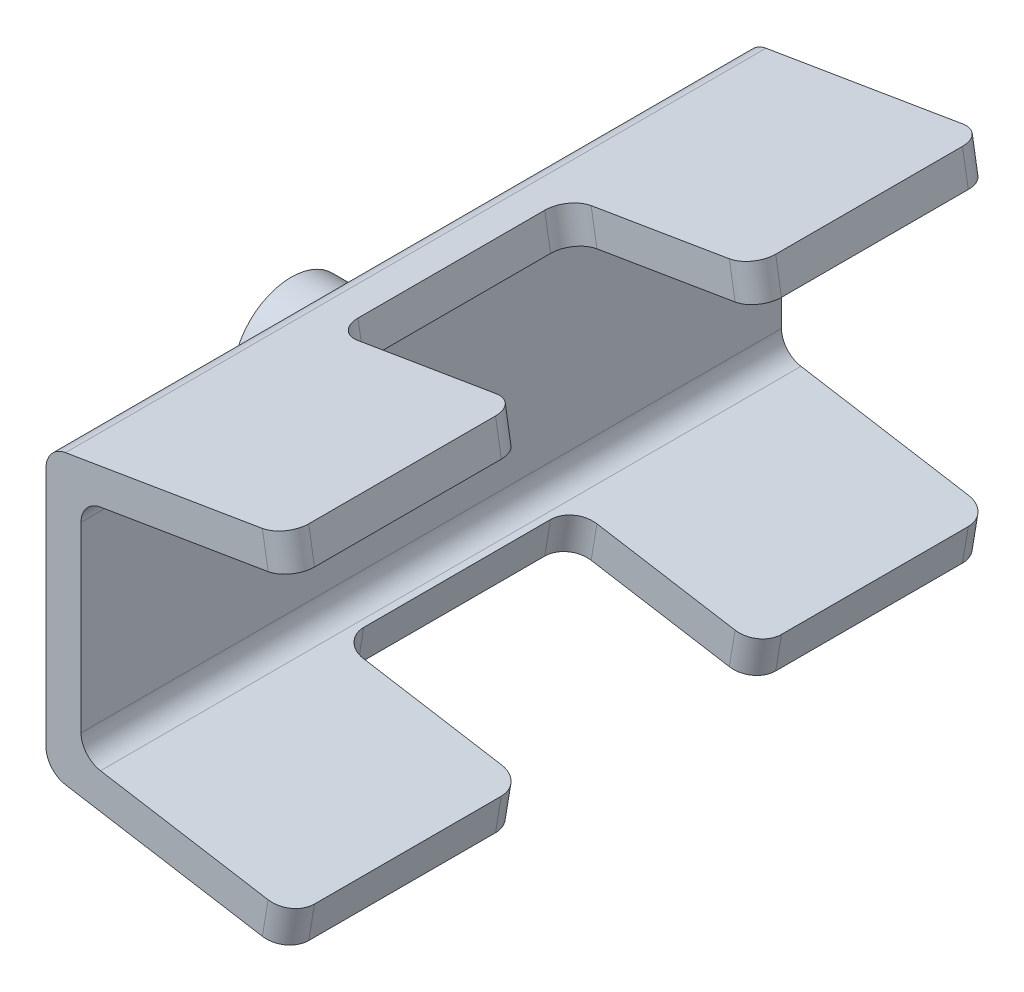
from build123d import *

# Parameters (mm, degrees)
SKETCH1_R           = 63.5
BOSS_EXTRUDE1_DEPTH = 63.5
BOSS_EXTRUDE2_DEPTH = 381
CUT_EXTRUDE1_DEPTH  = 203.2
CUT_EXTRUDE2_DEPTH  = 203.2
FILLET1_R           = 25.4
FILLET2_R           = 25.4
FILLET3_R           = 25.4


with BuildPart() as part:
    # Sketch1 → Boss-Extrude1 (new, symmetric)
    with BuildSketch(Plane(origin=(0, 0, 0), x_dir=(0, 0, -1), z_dir=(1, 0, 0))):
        Circle(SKETCH1_R)
    extrude(amount=BOSS_EXTRUDE1_DEPTH, both=True)

    # Sketch2 → Boss-Extrude2 (add, symmetric)
    with BuildSketch(Plane.XY):
        Polygon((88.9, -120.65), (88.9, 120.65), (317.5, 158.75), (311.236398584, 196.331608498), (50.8, 152.925542067), (50.8, -152.925542067), (311.236398584, -196.331608498), (317.5, -158.75), align=None)
    extrude(amount=BOSS_EXTRUDE2_DEPTH, both=True)

    # Sketch3 → Cut-Extrude1 (cut)
    with BuildSketch(Plane(origin=(334.662162162, 55.777027027, 0), x_dir=(0, 0, -1), z_dir=(0.986393923832144, 0.16439898730535665, 0))):
        Polygon((0, 104.393356939), (-127, 104.393356939), (-127, 142.493356939), (127, 142.493356939), (127, 104.393356939), align=None)
    extrude(amount=-CUT_EXTRUDE1_DEPTH, mode=Mode.SUBTRACT)

    # Sketch4 → Cut-Extrude2 (cut)
    with BuildSketch(Plane(origin=(334.662162162, -55.777027027, 0), x_dir=(0, 0, -1), z_dir=(0.9863939238321441, -0.16439898730535513, 0))):
        Polygon((0, -142.493356939), (-127, -142.493356939), (-127, -104.393356939), (127, -104.393356939), (127, -142.493356939), align=None)
    extrude(amount=-CUT_EXTRUDE2_DEPTH, mode=Mode.SUBTRACT)

    # Fillet1
    fillet1_edges = [part.edges().sort_by_distance(p)[0] for p in [
        (88.9, 120.65, 0),
        (88.9, -120.65, 0),
    ]]
    fillet(fillet1_edges, radius=FILLET1_R)

    # Fillet2
    fillet2_edges = [part.edges().sort_by_distance(p)[0] for p in [
        (50.8, -152.925542067, 0),
        (50.8, 152.925542067, 0),
    ]]
    fillet(fillet2_edges, radius=FILLET2_R)

    # Fillet3
    fillet3_edges = [part.edges().sort_by_distance(p)[0] for p in [
        (314.368199292, -177.540804249, -381),
        (314.368199292, -177.540804249, -127),
        (314.368199292, -177.540804249, 381),
        (314.368199292, -177.540804249, 127),
        (113.932953969, -144.134930029, -127),
        (113.932953969, -144.134930029, 127),
        (314.368199292, 177.540804249, -381),
        (314.368199292, 177.540804249, 381),
        (314.368199292, 177.540804249, -127),
        (314.368199292, 177.540804249, 127),
        (113.932953969, 144.134930029, -127),
        (113.932953969, 144.134930029, 127),
    ]]
    fillet(fillet3_edges, radius=FILLET3_R)


solid = part.part
